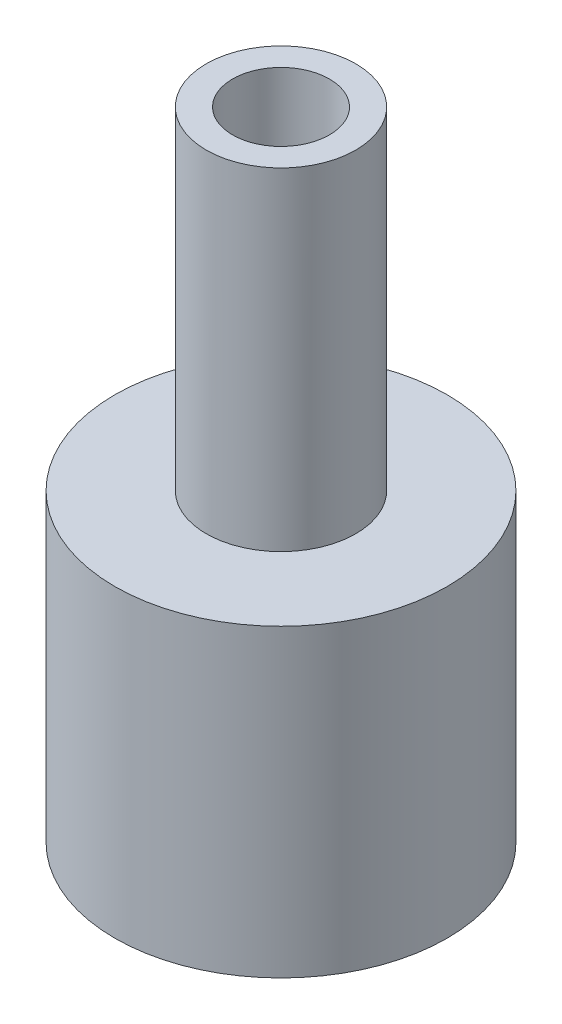
from build123d import *

# Parameters (mm, degrees)
SKETCH1_R               = 1.35
BOSS_EXTRUDE1_DEPTH     = 5.75
SKETCH2_R               = 3
BOSS_EXTRUDE2_DEPTH     = 5.5
CUT_EXTRUDE1_DEPTH      = 13.257650672
CUT_EXTRUDE1_DEPTH_BACK = 13.257650672
SKETCH3_R               = 0.875


with BuildPart() as part:
    # Sketch1 → Boss-Extrude1 (new, symmetric)
    with BuildSketch(Plane(origin=(0, 0, 0), x_dir=(1, 0, 0), z_dir=(0, 1, 0))):
        Circle(SKETCH1_R)
    extrude(amount=BOSS_EXTRUDE1_DEPTH, both=True)

    # Sketch2 → Boss-Extrude2 (add)
    with BuildSketch(Plane.XZ.offset(5.75)):
        Circle(SKETCH2_R)
    extrude(amount=-BOSS_EXTRUDE2_DEPTH)

    # Sketch3 → Cut-Extrude1 (cut, two sides: drawn at the far end of the back side and taken through both)
    with BuildSketch(Plane.XZ.offset(5.75).offset(-CUT_EXTRUDE1_DEPTH_BACK)):
        Circle(SKETCH3_R)
    extrude(amount=CUT_EXTRUDE1_DEPTH + CUT_EXTRUDE1_DEPTH_BACK, mode=Mode.SUBTRACT)


solid = part.part
